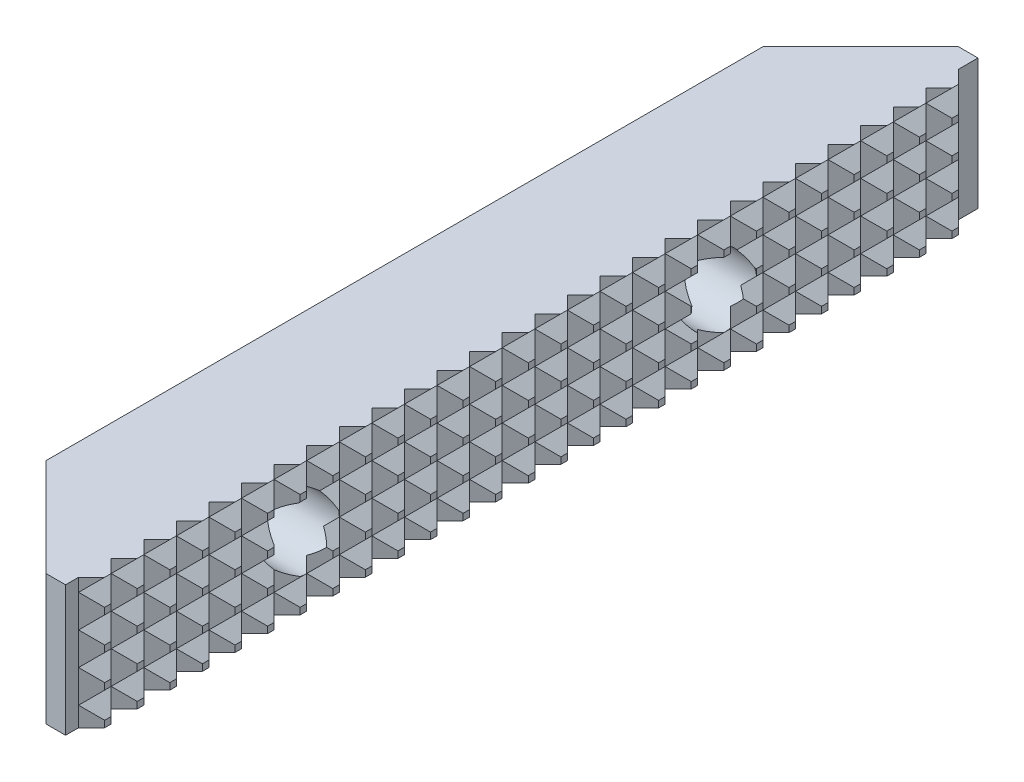
from build123d import *

# Parameters (mm, degrees)
SKIZZE1_W                       = 10
SKIZZE1_H                       = 10
AUFSATZ_LINEAR_AUSTRAGEN1_DEPTH = 70
SKIZZE2_R                       = 1.5
SCHNITT_LINEAR_AUSTRAGEN1_DEPTH = 70
SCHNITT_LINEAR_AUSTRAGEN2_DEPTH = 71.356236397
LINEARES_MUSTER1_COUNT          = 4
LINEARES_MUSTER1_PITCH          = 2.5
SCHNITT_LINEAR_AUSTRAGEN3_DEPTH = 71.887234394
LINEARES_MUSTER2_COUNT          = 28
LINEARES_MUSTER2_PITCH          = 2.5
SKIZZE6_R                       = 2.5
SCHNITT_LINEAR_AUSTRAGEN4_DEPTH = 5
SKIZZE7_W                       = 2.357520654
SKIZZE7_H                       = 2.200753805
SKIZZE7_W_2                     = 1.178760327
SKIZZE7_H_2                     = 1.772879687
SCHNITT_LINEAR_AUSTRAGEN5_DEPTH = 71.887234394
FASE1_SIZE                      = 7.5


with BuildPart() as part:
    # Skizze1 → Aufsatz-Linear austragen1 (new body)
    with BuildSketch(Plane.XY):
        Rectangle(SKIZZE1_W, SKIZZE1_H)
    extrude(amount=AUFSATZ_LINEAR_AUSTRAGEN1_DEPTH)

    # Skizze2 → Schnitt-Linear austragen1 (cut)
    with BuildSketch(Plane(origin=(5, 0, 0), x_dir=(0, 0, -1), z_dir=(1, 0, 0))):
        with Locations((-52.5, 0)):
            Circle(SKIZZE2_R)
        with Locations((-20.5, 0)):
            Circle(SKIZZE2_R)
    extrude(amount=-SCHNITT_LINEAR_AUSTRAGEN1_DEPTH, mode=Mode.SUBTRACT)

    # Skizze3 → Schnitt-Linear austragen2 (cut, symmetric)
    with BuildSketch(Plane.XY.offset(70)):
        Polygon((5, 5), (4, 4), (5, 3), align=None)
    schnitt_linear_austragen2 = extrude(amount=SCHNITT_LINEAR_AUSTRAGEN2_DEPTH, both=True, mode=Mode.SUBTRACT)

    # Lineares Muster1: Schnitt-Linear austragen2 ×4
    with Locations(*[(0, -i * LINEARES_MUSTER1_PITCH, 0) for i in range(1, LINEARES_MUSTER1_COUNT)]):
        add(schnitt_linear_austragen2, mode=Mode.SUBTRACT)

    # Skizze4 → Schnitt-Linear austragen3 (cut, symmetric)
    with BuildSketch(Plane(origin=(0, 5, 0), x_dir=(1, 0, 0), z_dir=(0, 1, 0))):
        Polygon((5, -70), (4, -69), (5, -68), align=None)
    schnitt_linear_austragen3 = extrude(amount=SCHNITT_LINEAR_AUSTRAGEN3_DEPTH, both=True, mode=Mode.SUBTRACT)

    # Lineares Muster2: Schnitt-Linear austragen3 ×28
    with Locations(*[(0, 0, -i * LINEARES_MUSTER2_PITCH) for i in range(1, LINEARES_MUSTER2_COUNT)]):
        add(schnitt_linear_austragen3, mode=Mode.SUBTRACT)

    # Skizze6 → Schnitt-Linear austragen4 (cut)
    with BuildSketch(Plane(origin=(5, 0, 0), x_dir=(0, 0, -1), z_dir=(1, 0, 0))):
        with Locations((-52.5, 0)):
            Circle(SKIZZE6_R)
        with Locations((-20.5, 0)):
            Circle(SKIZZE6_R)
    extrude(amount=-SCHNITT_LINEAR_AUSTRAGEN4_DEPTH, mode=Mode.SUBTRACT)

    # Skizze7 → Schnitt-Linear austragen5 (cut, through all)
    with BuildSketch(Plane.XZ.offset(5)):
        with Locations((5.178760327, 0.399623097)):
            Rectangle(SKIZZE7_W, SKIZZE7_H)
        with Locations((4.589380163, 69.886439843)):
            Rectangle(SKIZZE7_W_2, SKIZZE7_H_2)
    extrude(amount=-SCHNITT_LINEAR_AUSTRAGEN5_DEPTH, mode=Mode.SUBTRACT)

    # Fase1
    fase1_edges = [part.edges().sort_by_distance(p)[0] for p in [
        (-5, 0, 0),
        (-5, 0, 70),
    ]]
    chamfer(fase1_edges, length=FASE1_SIZE)


solid = part.part
